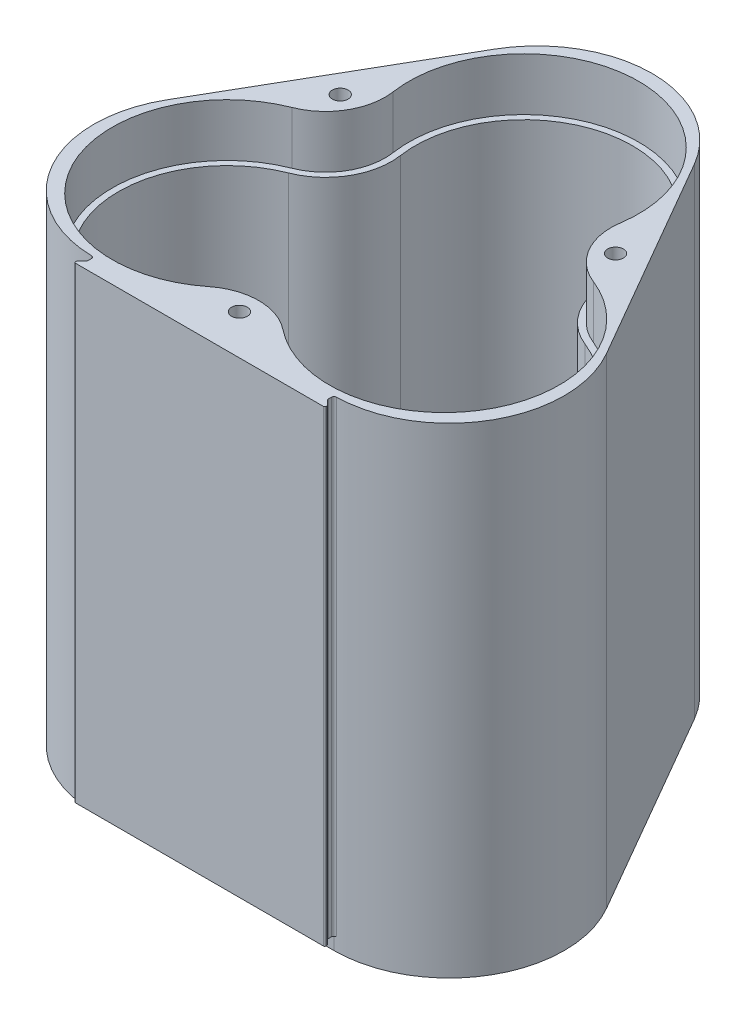
from build123d import *

# Parameters (mm, degrees)
BOSS_EXTRUDE1_DEPTH   = 71
BOSS_EXTRUDE1_2_DEPTH = 71
CUT_EXTRUDE1_START    = -71
CUT_EXTRUDE1_DEPTH    = 71
FILLET1_DEPTH         = 71
FILLET2_R             = 17.5
BOSS_EXTRUDE2_DEPTH   = 2
CUT_EXTRUDE2_REACH    = 128.609
SKETCH5_R             = 1.2
CUT_EXTRUDE3_DEPTH    = 10
CUT_EXTRUDE4_DEPTH    = 8
BOSS_EXTRUDE3_DEPTH   = 71
FILLET3_R             = 0.4
FILLET4_R             = 0.2


with BuildPart() as part:
    # Sketch1 → Boss-Extrude1 (new body)
    with BuildSketch(Plane(origin=(0, 0, 0), x_dir=(1, 0, 0), z_dir=(0, 1, 0))):
        Polygon((-3.464101615, -2), (93.621778265, -2), (45.078838325, 82.078838325), align=None)
        with BuildLine():
            ThreePointArc((53.328838206, 30.789419094), (75.868257522, 8.250000059), (45.078838325, 16.5))
            ThreePointArc((45.078838325, 16.5), (14.289419055, 8.250000187), (36.828838698, 30.789418947))
            ThreePointArc((36.828838698, 30.789418947), (45.078838178, 61.578838325), (53.328838206, 30.789419094))
        make_face(mode=Mode.SUBTRACT)
    extrude(amount=BOSS_EXTRUDE1_DEPTH)

    # Fillet1: read off the stored shape, not the designer's step
    # Fillet1 outline → Fillet1 (cut)
    with BuildSketch(Plane(origin=(0, 0, 0), x_dir=(1, 0, 0), z_dir=(0, 1, 0))):
        with BuildLine():
            ThreePointArc((53.328838325, 30.789419162), (60.354714381, 32.954528877), (67.623619549, 31.852870088))
            ThreePointArc((67.623619549, 31.852870088), (62.626869283, 36.157639839), (61.397204455, 42.637337381))
            ThreePointArc((61.397204455, 42.637337381), (58.716816368, 35.791451453), (53.328838325, 30.789419162))
        make_face()
        with BuildLine():
            ThreePointArc((38.852423231, 3.588630855), (45.078838325, 5.763558647), (51.305253419, 3.588630855))
            ThreePointArc((51.305253419, 3.588630855), (46.716736338, 9.332857994), (45.078838325, 16.5))
            ThreePointArc((45.078838325, 16.5), (43.440940312, 9.332857994), (38.852423231, 3.588630855))
        make_face()
        with BuildLine():
            ThreePointArc((36.828838325, 30.789419162), (31.440860282, 35.791451453), (28.760472195, 42.637337381))
            ThreePointArc((28.760472195, 42.637337381), (27.530807367, 36.157639839), (22.534057101, 31.852870089))
            ThreePointArc((22.534057101, 31.852870089), (29.802962269, 32.954528877), (36.828838325, 30.789419162))
        make_face()
    extrude(amount=FILLET1_DEPTH, mode=Mode.SUBTRACT)

    # Fillet2
    fillet2_edges = [part.edges().sort_by_distance(p)[0] for p in [
        (93.621778265, 35.5, 2),
        (-3.464101615, 35.5, 2),
        (45.078838325, 35.5, -82.078838325),
    ]]
    fillet(fillet2_edges, radius=FILLET2_R)

    # Sketch3 → Boss-Extrude2 (add)
    with BuildSketch(Plane.XZ):
        with BuildLine():
            Line((60.234282891, -55.828838325), (78.466333699, -24.25))
            ThreePointArc((78.466333699, -24.25), (78.466333699, -6.75), (63.310889132, 2))
            Line((63.310889132, 2), (26.846787517, 2))
            ThreePointArc((26.846787517, 2), (11.691342951, -6.75), (11.691342951, -24.25))
            Line((11.691342951, -24.25), (29.923393759, -55.828838325))
            ThreePointArc((29.923393759, -55.828838325), (45.078838325, -64.578838325), (60.234282891, -55.828838325))
        make_face()
    extrude(amount=BOSS_EXTRUDE2_DEPTH)

    # Sketch4 → Cut-Extrude2 (cut, up to next)
    with BuildSketch(Plane.XZ.offset(2), mode=Mode.PRIVATE) as cut_extrude2_sk1:
        with BuildLine():
            Line((63.310889132, -10.5), (26.846787517, -10.5))
            ThreePointArc((26.846787517, -10.5), (22.516660498, -13), (22.516660498, -18))
            Line((22.516660498, -18), (40.748711306, -49.578838325))
            ThreePointArc((40.748711306, -49.578838325), (45.078838325, -52.078838325), (49.408965344, -49.578838325))
            Line((49.408965344, -49.578838325), (67.641016151, -18))
            ThreePointArc((67.641016151, -18), (67.641016151, -13), (63.310889132, -10.5))
        make_face()
    cut_extrude2_tool1 = extrude(cut_extrude2_sk1.sketch, amount=-CUT_EXTRUDE2_REACH, mode=Mode.PRIVATE) & part.part
    add(cut_extrude2_tool1.solids().sort_by_distance((45.078838, -2, -26.026279))[0], mode=Mode.SUBTRACT)

    # Sketch5 → Cut-Extrude3 (cut)
    with BuildSketch(Plane(origin=(0, 71, 0), x_dir=(1, 0, 0), z_dir=(0, 1, 0))):
        with Locations(Location((45.078838325, 1.875, 0), (0, 0, 270))):
            Circle(SKETCH5_R)
        with Locations(Location((24.163216795, 38.101919162, 0), (0, 0, 270))):
            Circle(SKETCH5_R)
        with Locations(Location((65.994459855, 38.101919162, 0), (0, 0, 270))):
            Circle(SKETCH5_R)
    extrude(amount=-CUT_EXTRUDE3_DEPTH, mode=Mode.SUBTRACT)

    # Sketch7 → Cut-Extrude4 (cut)
    with BuildSketch(Plane(origin=(0, 71, 0), x_dir=(1, 0, 0), z_dir=(0, 1, 0))):
        with BuildLine():
            ThreePointArc((50.713743985, 2.845248996), (45.078838325, 4.813558647), (39.443932665, 2.845248996))
            ThreePointArc((39.443932665, 2.845248996), (13.466695029, 7.775), (22.186024243, 32.736823215))
            ThreePointArc((22.186024243, 32.736823215), (26.708083233, 36.632639839), (27.820929903, 42.496766114))
            ThreePointArc((27.820929903, 42.496766114), (45.078838325, 62.528838325), (62.336746747, 42.496766114))
            ThreePointArc((62.336746747, 42.496766114), (63.449593417, 36.632639839), (67.971652407, 32.736823215))
            ThreePointArc((67.971652407, 32.736823215), (76.690981621, 7.775), (50.713743985, 2.845248996))
        make_face()
    extrude(amount=-CUT_EXTRUDE4_DEPTH, mode=Mode.SUBTRACT)

    # Sketch8 → Boss-Extrude3 (add, through all)
    with BuildSketch(Plane(origin=(0, 0, 0), x_dir=(1, 0, 0), z_dir=(0, 1, 0))):
        Polygon((63.310889132, -2), (63.310889132, -3), (64.110889132, -3.8), (64.110889132, -4.2), (26.046787517, -4.2), (26.046787517, -3.8), (26.846787517, -3), (26.846787517, -2), align=None)
    extrude(amount=BOSS_EXTRUDE3_DEPTH)

    # Fillet3
    fillet3_edges = [part.edges().sort_by_distance(p)[0] for p in [
        (63.310889132, 35.5, 2),
        (26.846787517, 35.5, 3),
        (63.310889132, 35.5, 3),
        (26.846787517, 35.5, 2),
    ]]
    fillet(fillet3_edges, radius=FILLET3_R)

    # Fillet4
    fillet4_edges = [part.edges().sort_by_distance(p)[0] for p in [
        (26.046787517, 35.5, 3.8),
        (26.046787517, 35.5, 4.2),
        (64.110889132, 35.5, 4.2),
        (64.110889132, 35.5, 3.8),
    ]]
    fillet(fillet4_edges, radius=FILLET4_R)


with BuildPart() as body_2:
    # Sketch1 → Boss-Extrude1 2 (new body)
    with BuildSketch(Plane(origin=(0, 0, 0), x_dir=(1, 0, 0), z_dir=(0, 1, 0))):
        with BuildLine():
            ThreePointArc((36.828838698, 30.789418947), (42.868257595, 24.749999813), (45.078838325, 16.5))
            ThreePointArc((45.078838325, 16.5), (47.289419128, 24.749999941), (53.328838206, 30.789419094))
            ThreePointArc((53.328838206, 30.789419094), (45.078838472, 28.578838325), (36.828838698, 30.789418947))
        make_face()
    extrude(amount=BOSS_EXTRUDE1_2_DEPTH)

    # Sketch2 → Cut-Extrude1 (cut)
    with BuildSketch(Plane(origin=(0, 71, 0), x_dir=(1, 0, 0), z_dir=(0, 1, 0)).offset(CUT_EXTRUDE1_START)):
        with BuildLine():
            ThreePointArc((36.828838325, 30.789419162), (45.078838325, 28.578838325), (53.328838325, 30.789419162))
            ThreePointArc((53.328838325, 30.789419162), (47.289419162, 24.75), (45.078838325, 16.5))
            ThreePointArc((45.078838325, 16.5), (42.868257487, 24.75), (36.828838325, 30.789419162))
        make_face()
    extrude(amount=CUT_EXTRUDE1_DEPTH, mode=Mode.SUBTRACT)


solid = part.part
